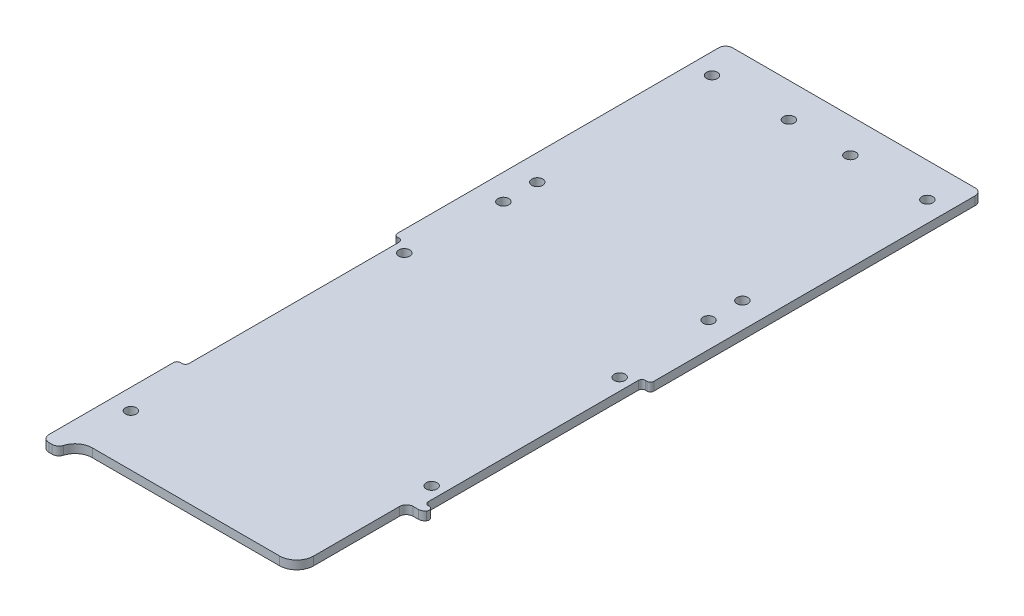
from build123d import *

# Parameters (mm, degrees)
SKETCH1_R               = 2.032
BOSS_EXTRUDE1_DEPTH     = 3.175
FILLET1_R               = 2.54
FILLET2_R               = 2.54
FILLET3_R               = 6.35
CUT_EXTRUDE1_DEPTH      = 136.673215063
FILLET4_R               = 6.35
FILLET5_R               = 2.54
SKETCH3_R               = 2.032
CUT_EXTRUDE2_DEPTH      = 136.673215063
CUT_EXTRUDE3_DEPTH      = 136.673215063
CUT_EXTRUDE3_DEPTH_BACK = 136.673215063
SKETCH4_W               = 3.175
SKETCH4_H               = 80.645
FILLET6_R               = 1.27


with BuildPart() as part:
    # Sketch1 → Boss-Extrude1 (new body)
    with BuildSketch(Plane(origin=(0, 0, 0), x_dir=(1, 0, 0), z_dir=(0, 1, 0))):
        Polygon((47.625, 127), (-47.625, 127), (-47.625, -127), (-41.275, -127), (-41.275, -120.65), (41.275, -120.65), (41.275, -127), (47.625, -127), align=None)
        with Locations((-39.999684148, -101.6)):
            Circle(SKETCH1_R, mode=Mode.SUBTRACT)
        with Locations((39.999684148, -69.85)):
            Circle(SKETCH1_R, mode=Mode.SUBTRACT)
        with Locations((-39.999684148, 0)):
            Circle(SKETCH1_R, mode=Mode.SUBTRACT)
        with Locations((-39.999684148, 114.3)):
            Circle(SKETCH1_R, mode=Mode.SUBTRACT)
        with Locations((-11.424684148, 114.3)):
            Circle(SKETCH1_R, mode=Mode.SUBTRACT)
        with Locations((39.999684148, 0)):
            Circle(SKETCH1_R, mode=Mode.SUBTRACT)
        with Locations((11.424684148, 114.3)):
            Circle(SKETCH1_R, mode=Mode.SUBTRACT)
        with Locations((39.999684148, 114.3)):
            Circle(SKETCH1_R, mode=Mode.SUBTRACT)
    extrude(amount=BOSS_EXTRUDE1_DEPTH)

    # Fillet1
    fillet1_edges = [part.edges().sort_by_distance(p)[0] for p in [
        (-47.625, 1.5875, -127),
        (47.625, 1.5875, -127),
        (47.625, 1.5875, 127),
        (-47.625, 1.5875, 127),
    ]]
    fillet(fillet1_edges, radius=FILLET1_R)

    # Fillet2
    fillet2_edges = [part.edges().sort_by_distance(p)[0] for p in [
        (41.275, 1.5875, 127),
        (-41.275, 1.5875, 127),
    ]]
    fillet(fillet2_edges, radius=FILLET2_R)

    # Fillet3
    fillet3_edges = [part.edges().sort_by_distance(p)[0] for p in [
        (41.275, 1.5875, 120.65),
        (-41.275, 1.5875, 120.65),
    ]]
    fillet(fillet3_edges, radius=FILLET3_R)

    # Sketch2 → Cut-Extrude1 (cut, through all)
    with BuildSketch(Plane.XZ):
        with BuildLine():
            Line((40.64508, 123.578690235), (40.64508, 79.88808))
            Line((40.64508, 79.88808), (47.625, 79.88808))
            Line((47.625, 79.88808), (47.625, 124.46))
            ThreePointArc((47.625, 124.46), (46.881051224, 126.256051224), (45.085, 127))
            Line((45.085, 127), (43.815, 127))
            ThreePointArc((43.815, 127), (42.297059666, 126.496530663), (41.380880287, 125.185714286))
            ThreePointArc((41.380880287, 125.185714286), (41.069166069, 124.356476684), (40.64508, 123.578690235))
        make_face()
    extrude(amount=-CUT_EXTRUDE1_DEPTH, mode=Mode.SUBTRACT)

    # Fillet4
    fillet4_edges = [part.edges().sort_by_distance(p)[0] for p in [
        (40.64508, 1.5875, 123.578690235),
    ]]
    fillet(fillet4_edges, radius=FILLET4_R)

    # Fillet5
    fillet5_edges = [part.edges().sort_by_distance(p)[0] for p in [
        (47.625, 1.5875, 79.88808),
        (40.64508, 1.5875, 79.88808),
    ]]
    fillet(fillet5_edges, radius=FILLET5_R)

    # Sketch3 → Cut-Extrude2 (cut, through all)
    with BuildSketch(Plane.XZ):
        with Locations((-38.105652799, -34.913768806)):
            Circle(SKETCH3_R)
        with Locations((-38.105652799, -47.490173279)):
            Circle(SKETCH3_R)
        with Locations((38.105652799, -47.490173279)):
            Circle(SKETCH3_R)
        with Locations((38.105652799, -34.913768806)):
            Circle(SKETCH3_R)
    extrude(amount=-CUT_EXTRUDE2_DEPTH, mode=Mode.SUBTRACT)

    # Sketch4 → Cut-Extrude3 (cut, two sides: drawn at the far end of the back side and taken through both)
    with BuildSketch(Plane(origin=(0, 3.175, 0), x_dir=(1, 0, 0), z_dir=(0, 1, 0)).offset(-CUT_EXTRUDE3_DEPTH_BACK)):
        with Locations((-46.0375, -36.5125)):
            Rectangle(SKETCH4_W, SKETCH4_H)
        with Locations((46.0375, -36.5125)):
            Rectangle(SKETCH4_W, SKETCH4_H)
    extrude(amount=CUT_EXTRUDE3_DEPTH + CUT_EXTRUDE3_DEPTH_BACK, mode=Mode.SUBTRACT)

    # Fillet6
    fillet6_edges = [part.edges().sort_by_distance(p)[0] for p in [
        (-44.45, 1.5875, -3.81),
        (-47.625, 1.5875, -3.81),
        (-47.625, 1.5875, 76.835),
        (-44.45, 1.5875, 76.835),
        (44.45, 1.5875, 76.835),
        (47.625, 1.5875, 76.835),
        (44.45, 1.5875, -3.81),
        (47.625, 1.5875, -3.81),
    ]]
    fillet(fillet6_edges, radius=FILLET6_R)


solid = part.part
